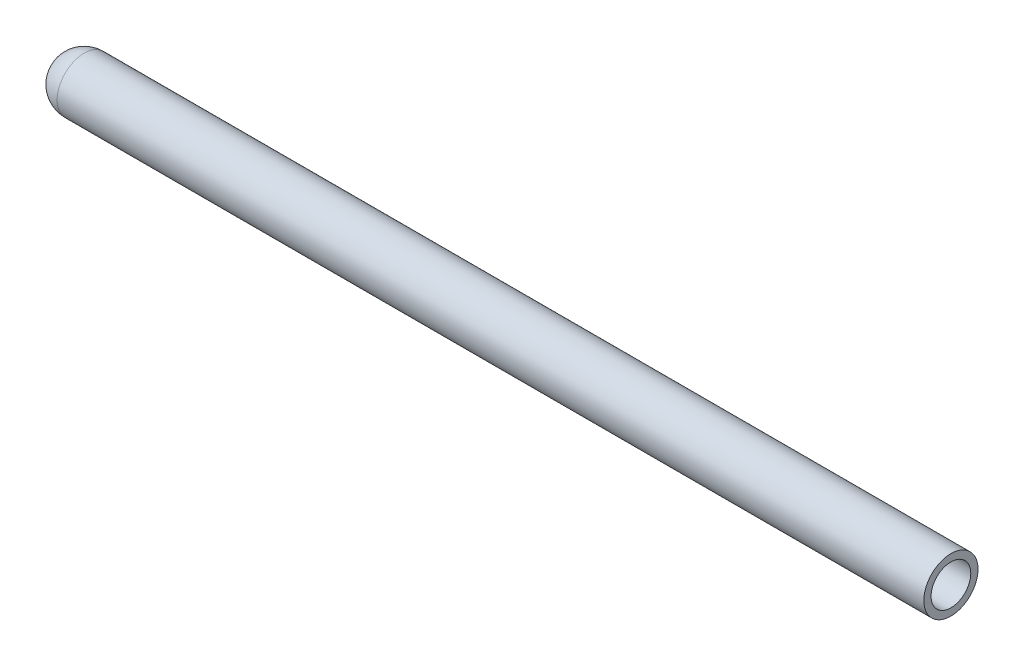
from build123d import *

# Parameters (mm, degrees)
SKETCH1_R           = 9.525
BOSS_EXTRUDE1_DEPTH = 304.8
DOME1_FACE_RADIUS   = 9.525
DOME1_HEIGHT        = 9.525


# Read off the part's stored shape, not the designer's step: Shell1
with BuildPart() as part:
    # Sketch1 → Boss-Extrude1 (new body)
    with BuildSketch(Plane(origin=(0, 0, 0), x_dir=(0, 0, -1), z_dir=(1, 0, 0))):
        Circle(SKETCH1_R)
    extrude(amount=-BOSS_EXTRUDE1_DEPTH)

    # Dome1: a dome of height H over a round flat face of radius A is a cap of a sphere of radius (A * A + H * H) / (2 * H)
    dome1_r = (DOME1_FACE_RADIUS * DOME1_FACE_RADIUS + DOME1_HEIGHT * DOME1_HEIGHT) / (2 * DOME1_HEIGHT)
    dome1_base = Plane((-304.8, 0, 0), z_dir=(-1, 0, 0))
    with Locations(dome1_base.offset(DOME1_HEIGHT - dome1_r)):
        dome1_ball = Sphere(dome1_r, mode=Mode.PRIVATE)
    add(split(dome1_ball, bisect_by=dome1_base, keep=Keep.TOP, mode=Mode.PRIVATE))

    # Shell1 outline → Shell1 (revolve, cut)
    with BuildSketch(Plane.YX):
        with BuildLine():
            ThreePointArc((0, -311.785), (4.939140869, -309.739140864), (6.985, -304.799999993))
            Line((6.985, -304.799999993), (6.985, 0))
            Line((6.985, 0), (0, 0))
            Line((0, 0), (0, -311.785))
        make_face()
    revolve(axis=Axis((0, 0, 0), (1, 0, 0)), mode=Mode.SUBTRACT)


solid = part.part
